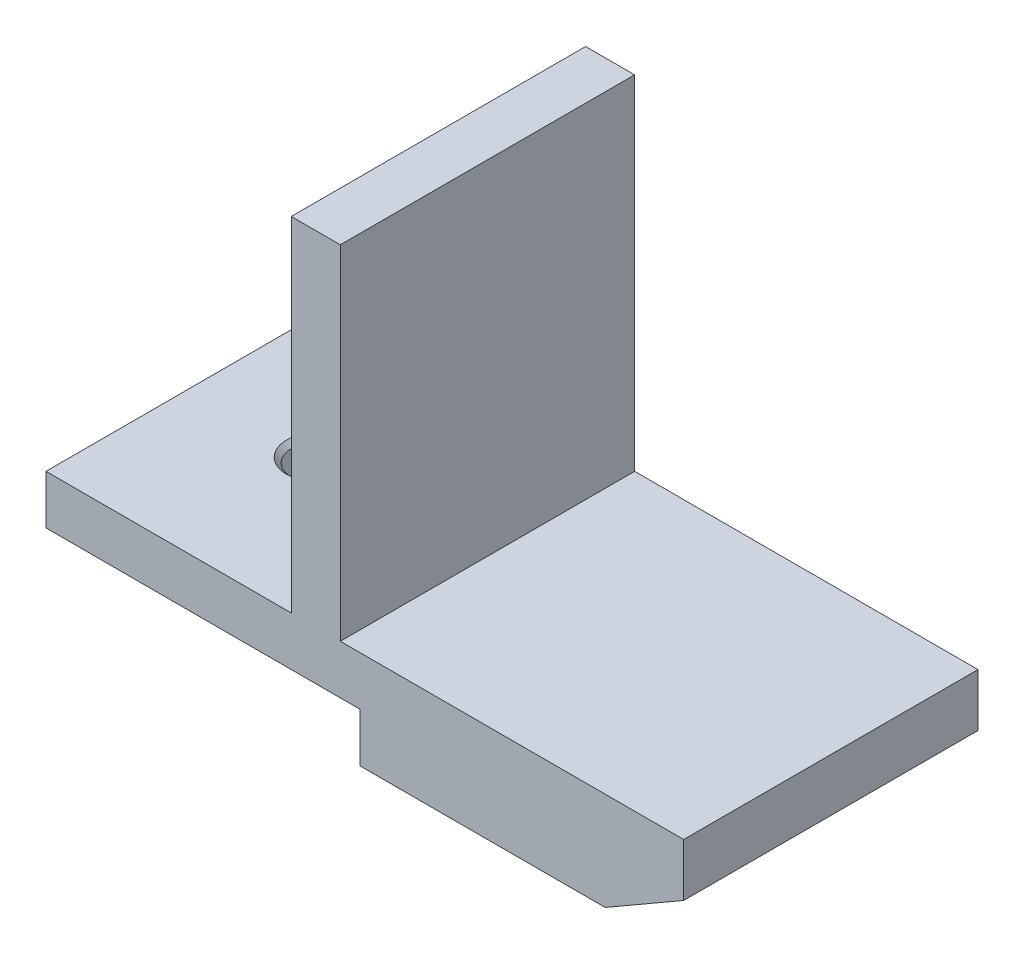
from build123d import *

# Parameters (mm, degrees)
BOSS_EXTRUDE1_DEPTH                   = 38.1
F_1_4_0_25_DIAMETER_HOLE1_D           = 6.35
F_1_4_0_25_DIAMETER_HOLE1_CSINK_D     = 7.62
F_1_4_0_25_DIAMETER_HOLE1_CSINK_ANGLE = 90
CHAMFER1_SIZE                         = 10.16
CHAMFER1_SIZE2                        = 5.865878735


with BuildPart() as part:
    # Sketch1 → Boss-Extrude1 (new body)
    with BuildSketch(Plane.XY):
        Polygon((0, 0), (44.45, 0), (44.45, -12.7), (2.54, -12.7), (2.54, -6.35), (-38.1, -6.35), (-38.1, 0), (-6.35, 0), (-6.35, 44.45), (0, 44.45), align=None)
    extrude(amount=BOSS_EXTRUDE1_DEPTH)

    # 1/4 (0.25) Diameter Hole1 (through all)
    with Locations(Plane(origin=(0, 0, 0), x_dir=(1, 0, 0), z_dir=(0, 1, 0))):
        with Locations((-22.225, -19.05)):
            CounterSinkHole(F_1_4_0_25_DIAMETER_HOLE1_D / 2, F_1_4_0_25_DIAMETER_HOLE1_CSINK_D / 2, counter_sink_angle=F_1_4_0_25_DIAMETER_HOLE1_CSINK_ANGLE)

    # Chamfer1
    chamfer1_edges = [part.edges().sort_by_distance(p)[0] for p in [
        (44.45, -12.7, 19.05),
    ]]
    chamfer1_side = [part.faces().sort_by_distance(p)[0] for p in [
        (23.495, -12.7, 19.05),
    ]]
    chamfer(chamfer1_edges, length=CHAMFER1_SIZE, length2=CHAMFER1_SIZE2, reference=chamfer1_side[0])


solid = part.part
